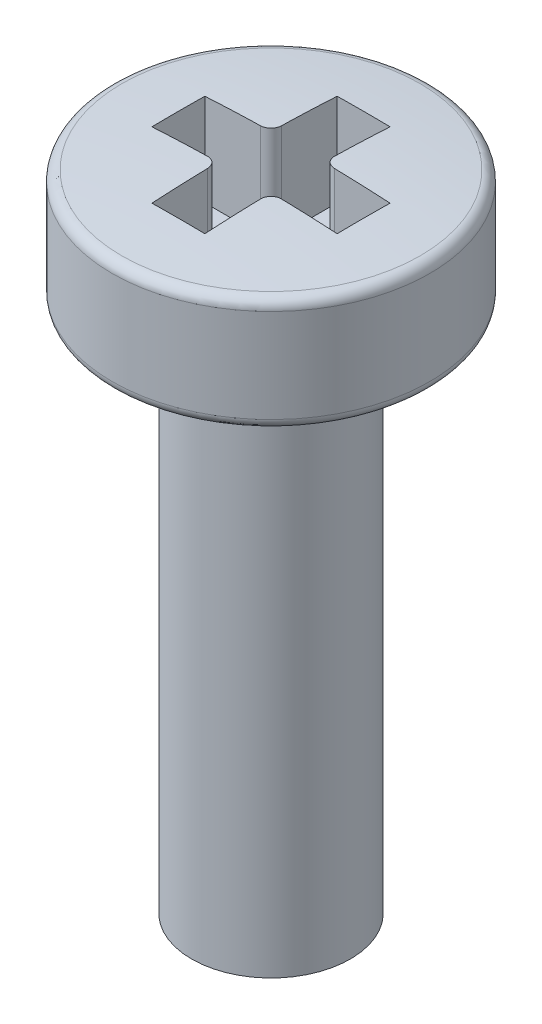
from build123d import *

# Parameters (mm, degrees)
CROQUIS1_R              = 1.5
SALIENTE_EXTRUIR1_DEPTH = 10
CORTAR_EXTRUIR1_DEPTH   = 2.5


with BuildPart() as part:
    # Croquis1 → Saliente-Extruir1 (new body)
    with BuildSketch(Plane(origin=(0, 0, 0), x_dir=(1, 0, 0), z_dir=(0, 1, 0))):
        Circle(CROQUIS1_R)
    extrude(amount=SALIENTE_EXTRUIR1_DEPTH)

    # Croquis4 → Revolución1 (revolve)
    with BuildSketch(Plane.XY):
        with BuildLine():
            Line((0, 10), (2.8, 10))
            ThreePointArc((2.8, 10), (2.941421356, 10.058578644), (3, 10.2))
            Line((3, 10.2), (3, 11.968164756))
            ThreePointArc((3, 11.968164756), (2.947916174, 12.102778297), (2.818791946, 12.167279956))
            ThreePointArc((2.818791946, 12.167279956), (1.410957356, 12.26680162), (0, 12.3))
            Line((0, 12.3), (0, 10))
        make_face()
    revolve(axis=Axis((0, 10, 0), (0, 1, 0)))

    # Croquis5 → Cortar-Extruir1 (cut)
    with BuildSketch(Plane(origin=(0, 13, 0), x_dir=(1, 0, 0), z_dir=(0, 1, 0))):
        with BuildLine():
            Line((-0.5, -0.7), (-0.5, -1.75))
            Line((-0.5, -1.75), (0.5, -1.75))
            Line((0.5, -1.75), (0.5, -0.7))
            ThreePointArc((0.5, -0.7), (0.558578644, -0.558578644), (0.7, -0.5))
            Line((0.7, -0.5), (1.75, -0.5))
            Line((1.75, -0.5), (1.75, 0.5))
            Line((1.75, 0.5), (0.7, 0.5))
            ThreePointArc((0.7, 0.5), (0.558578644, 0.558578644), (0.5, 0.7))
            Line((0.5, 0.7), (0.5, 1.75))
            Line((0.5, 1.75), (-0.5, 1.75))
            Line((-0.5, 1.75), (-0.5, 0.7))
            ThreePointArc((-0.5, 0.7), (-0.558578644, 0.558578644), (-0.7, 0.5))
            Line((-0.7, 0.5), (-1.75, 0.5))
            Line((-1.75, 0.5), (-1.75, -0.5))
            Line((-1.75, -0.5), (-0.7, -0.5))
            ThreePointArc((-0.7, -0.5), (-0.558578644, -0.558578644), (-0.5, -0.7))
        make_face()
    extrude(amount=-CORTAR_EXTRUIR1_DEPTH, mode=Mode.SUBTRACT)


solid = part.part
